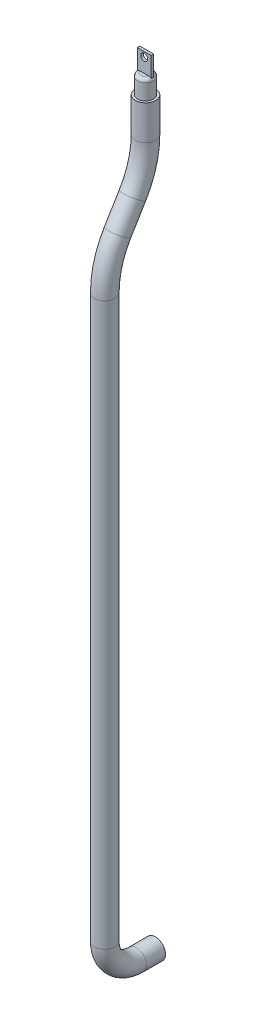
from build123d import *

# Parameters (mm, degrees)
BARRER1_PROFILE_R            = 16
CROQUIS13_R                  = 12.462499683
SALIENTE_EXTRUIR1_DEPTH      = 30
SALIENTE_EXTRUIR2_DEPTH      = 2
SALIENTE_EXTRUIR2_DEPTH_BACK = 2
CROQUIS15_W                  = 22
CROQUIS15_H                  = 30
CROQUIS15_R                  = 5.5
REDONDEO1_R                  = 5


with BuildPart() as part:
    # Barrer1: sweep along a curve in space
    with BuildLine() as barrer1_path:
        Line((1505.090032208, -551.240046142, 2179.521039666), (1505.090032208, -605.839285822, 2179.521039666))
        ThreePointArc((1505.090032208, -605.839285822, 2179.521039666), (1505.090032208, -643.580384492, 2184.704091655), (1505.090032208, -678.526996356, 2199.869475793))
        Line((1505.090032208, -678.526996356, 2199.869475793), (1505.090032208, -717.466920568, 2223.52527976))
        ThreePointArc((1505.090032208, -717.466920568, 2223.52527976), (1505.090032208, -752.413532431, 2238.690663898), (1505.090032208, -790.154631102, 2243.873715887))
        Line((1505.090032208, -790.154631102, 2243.873715887), (1505.090032208, -1677.615278398, 2243.873715887))
        ThreePointArc((1505.090032208, -1677.615278398, 2243.873715887), (1505.090032208, -1712.970617457, 2229.229054946), (1505.090032208, -1727.615278398, 2193.873715887))
        Line((1505.090032208, -1727.615278398, 2193.873715887), (1505.090032208, -1727.615278398, 2163.873715887))
    # Barrer1 profile (on start of the path) → Barrer1 (sweep)
    with BuildSketch(Plane(origin=(1505.090032208, -551.240046142, 2179.521039666), x_dir=(0, 0, -1), z_dir=(0, -1, 0))):
        Circle(BARRER1_PROFILE_R)
    sweep(path=barrer1_path.line)

    # Croquis13 → Saliente-Extruir1 (add)
    with BuildSketch(Plane(origin=(0, -551.240046142, 0), x_dir=(1, 0, 0), z_dir=(0, 1, 0))):
        with Locations(Location((1505.090032208, -2179.521039666, 0), (0, 0, 270))):
            Circle(CROQUIS13_R)
    extrude(amount=SALIENTE_EXTRUIR1_DEPTH)

    # Croquis15 → Saliente-Extruir2 (add, two sides: drawn at the far end of the back side and taken through both)
    with BuildSketch(Plane.XY.offset(2179.521039666).offset(-SALIENTE_EXTRUIR2_DEPTH_BACK)):
        with Locations((1505.090032208, -506.240046142)):
            Rectangle(CROQUIS15_W, CROQUIS15_H)
        with Locations((1505.090032208, -499.005171033)):
            Circle(CROQUIS15_R, mode=Mode.SUBTRACT)
    extrude(amount=SALIENTE_EXTRUIR2_DEPTH + SALIENTE_EXTRUIR2_DEPTH_BACK)

    # Redondeo1
    # the kernel refuses this fillet: 5 mm, written as the material it takes off along each edge
    with BuildSketch(Plane(origin=(1505.090032208, -521.240046142, 2179.521039666), x_dir=(0, 0, 1), z_dir=(-1, 0, 0))) as redondeo1_piece_1_section:
        with BuildLine():
            CenterArc((12.462499683 - REDONDEO1_R, -REDONDEO1_R), REDONDEO1_R, 0, 90)
            Line((12.462499683 - REDONDEO1_R, 0), (12.462499683, 0))
            Line((12.462499683, 0), (12.462499683, -REDONDEO1_R))
        make_face()
    redondeo1_piece_1 = revolve(axis=Axis((1505.090032208, -521.240046142, 2179.521039666), (0, 1, 0)), mode=Mode.PRIVATE)
    redondeo1_piece_1 = split(redondeo1_piece_1, bisect_by=Plane(origin=(1512.161144528, -522.66682116, 2181.521039666), z_dir=(0, 0, 1)), keep=Keep.TOP, mode=Mode.PRIVATE)
    add(redondeo1_piece_1, mode=Mode.SUBTRACT)
    with BuildSketch(Plane(origin=(1505.090032208, -521.240046142, 2179.521039666), x_dir=(0, 0, 1), z_dir=(-1, 0, 0))) as redondeo1_piece_2_section:
        with BuildLine():
            CenterArc((12.462499683 - REDONDEO1_R, -REDONDEO1_R), REDONDEO1_R, 0, 90)
            Line((12.462499683 - REDONDEO1_R, 0), (12.462499683, 0))
            Line((12.462499683, 0), (12.462499683, -REDONDEO1_R))
        make_face()
    redondeo1_piece_2 = revolve(axis=Axis((1505.090032208, -521.240046142, 2179.521039666), (0, 1, 0)), mode=Mode.PRIVATE)
    redondeo1_piece_2 = split(redondeo1_piece_2, bisect_by=Plane(origin=(1505.090032208, -522.66682116, 2177.521039666), z_dir=(0, 0, -1)), keep=Keep.TOP, mode=Mode.PRIVATE)
    add(redondeo1_piece_2, mode=Mode.SUBTRACT)
    with BuildSketch(Plane(origin=(1505.090032208, -521.240046142, 2179.521039666), x_dir=(0, 0, 1), z_dir=(-1, 0, 0))) as redondeo1_piece_3_section:
        with BuildLine():
            CenterArc((12.462499683 - REDONDEO1_R, -REDONDEO1_R), REDONDEO1_R, 0, 90)
            Line((12.462499683 - REDONDEO1_R, 0), (12.462499683, 0))
            Line((12.462499683, 0), (12.462499683, -REDONDEO1_R))
        make_face()
    redondeo1_piece_3 = revolve(axis=Axis((1505.090032208, -521.240046142, 2179.521039666), (0, 1, 0)), mode=Mode.PRIVATE)
    redondeo1_piece_3 = split(redondeo1_piece_3, bisect_by=Plane(origin=(1516.090032208, -522.670135024, 2179.521039666), z_dir=(1, 0, 0)), keep=Keep.TOP, mode=Mode.PRIVATE)
    add(redondeo1_piece_3, mode=Mode.SUBTRACT)
    with BuildSketch(Plane(origin=(1505.090032208, -521.240046142, 2179.521039666), x_dir=(0, 0, 1), z_dir=(-1, 0, 0))) as redondeo1_piece_4_section:
        with BuildLine():
            CenterArc((12.462499683 - REDONDEO1_R, -REDONDEO1_R), REDONDEO1_R, 0, 90)
            Line((12.462499683 - REDONDEO1_R, 0), (12.462499683, 0))
            Line((12.462499683, 0), (12.462499683, -REDONDEO1_R))
        make_face()
    redondeo1_piece_4 = revolve(axis=Axis((1505.090032208, -521.240046142, 2179.521039666), (0, 1, 0)), mode=Mode.PRIVATE)
    redondeo1_piece_4 = split(redondeo1_piece_4, bisect_by=Plane(origin=(1494.090032208, -522.670134816, 2179.521039666), z_dir=(-1, 0, 0)), keep=Keep.TOP, mode=Mode.PRIVATE)
    add(redondeo1_piece_4, mode=Mode.SUBTRACT)


solid = part.part
